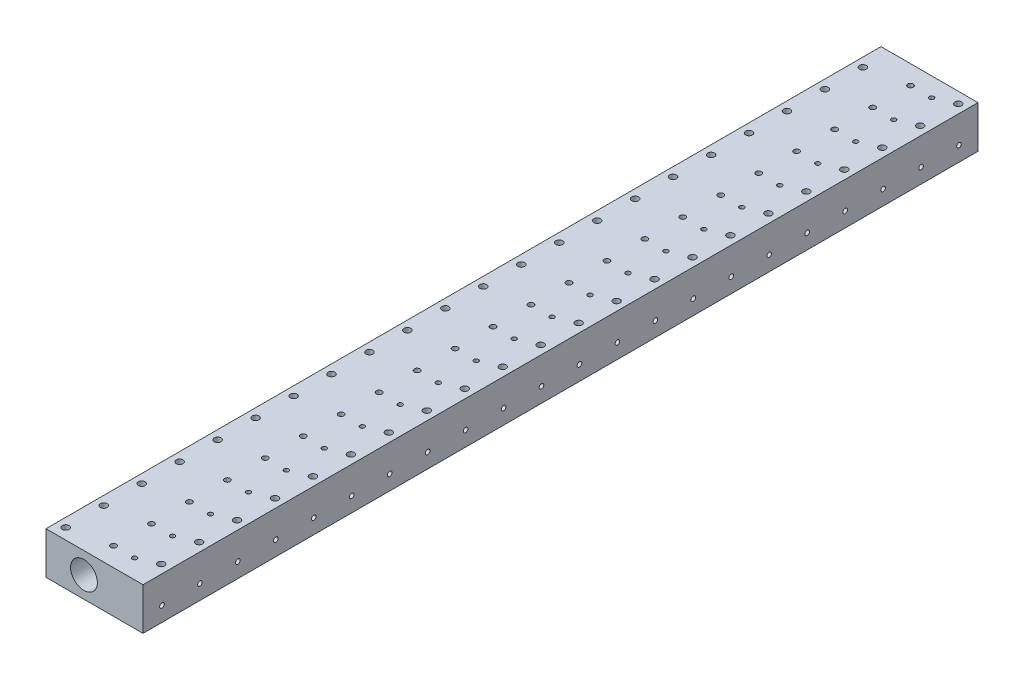
from build123d import *

# Parameters (mm, degrees)
SKETCH1_W                  = 23
SKETCH1_H                  = 10
BOSS_EXTRUDE1_DEPTH        = 198
SKETCH5_R                  = 3.175
CUT_EXTRUDE1_DEPTH         = 199.396698561
M2_TAPPED_HOLE1_AT_2_COUNT = 2
M2_TAPPED_HOLE1_AT_2_PITCH = 19.180198122
LPATTERN1_COUNT            = 22
LPATTERN1_PITCH            = 9


with BuildPart() as part:
    # Sketch1 → Boss-Extrude1 (new body)
    with BuildSketch(Plane.XY):
        Rectangle(SKETCH1_W, SKETCH1_H)
    extrude(amount=-BOSS_EXTRUDE1_DEPTH)

    # Sketch4 → #55 (0.052) Diameter Hole1 (revolve, cut)
    with BuildSketch(Plane(origin=(0, 5, -4.5), x_dir=(0, 0, 1), z_dir=(1, 0, 0))):
        Polygon((0, 0), (0, 7.396808353), (0.6604, 7), (0.6604, 0), align=None)
    f_55_0_052_diameter_hole1 = revolve(axis=Axis((0, 11.35, -4.5), (0, -1, 0)), mode=Mode.SUBTRACT)

    # Sketch5 → Cut-Extrude1 (cut, through all)
    with BuildSketch(Plane.XY):
        with Locations((-2.5, 0)):
            Circle(SKETCH5_R)
    extrude(amount=-CUT_EXTRUDE1_DEPTH, mode=Mode.SUBTRACT)

    # Sketch8 → M2 Tapped Hole1 (revolve, cut)
    with BuildSketch(Plane(origin=(9.4, 5, -6.4), x_dir=(0, 0, 1), z_dir=(1, 0, 0))):
        Polygon((0, 0), (0, 5.680688495), (0.8, 5.2), (0.8, 0), align=None)
    m2_tapped_hole1 = revolve(axis=Axis((9.4, 11.35, -6.4), (0, -1, 0)), mode=Mode.SUBTRACT)

    # M2 Tapped Hole1 at 2: M2 Tapped Hole1 ×2
    with Locations(*[Vector(-0.9801775706589259, 0, 0.1981209983246765) * (i * M2_TAPPED_HOLE1_AT_2_PITCH) for i in range(1, M2_TAPPED_HOLE1_AT_2_COUNT)]):
        add(m2_tapped_hole1, mode=Mode.SUBTRACT)

    # Sketch12 → #57 (0.043) Diameter Hole1 (revolve, cut)
    with BuildSketch(Plane(origin=(11.5, -1.5, -4.5), x_dir=(0, 0, -1), z_dir=(0, 1, 0))):
        Polygon((0, 0), (0, 6.328129984), (0.5461, 6), (0.5461, 0), align=None)
    f_57_0_043_diameter_hole1 = revolve(axis=Axis((17.85, -1.5, -4.5), (-1, 0, 0)), mode=Mode.SUBTRACT)

    # Sketch14 → #57 (0.043) Diameter Hole2 (revolve, cut)
    with BuildSketch(Plane(origin=(5, 5, -4.5), x_dir=(0, 0, 1), z_dir=(1, 0, 0))):
        Polygon((0, 0), (0, 7.828129984), (0.5461, 7.5), (0.5461, 0), align=None)
    f_57_0_043_diameter_hole2 = revolve(axis=Axis((5, 11.35, -4.5), (0, -1, 0)), mode=Mode.SUBTRACT)

    # LPattern1: #55 (0.052) Diameter Hole1, M2 Tapped Hole1, #57 (0.043) Diameter Hole1, #57 (0.043) Diameter Hole2 ×22
    with Locations(*[(0, 0, -i * LPATTERN1_PITCH) for i in range(1, LPATTERN1_COUNT)]):
        add(f_55_0_052_diameter_hole1, mode=Mode.SUBTRACT)
        add(m2_tapped_hole1, mode=Mode.SUBTRACT)
        add(f_57_0_043_diameter_hole1, mode=Mode.SUBTRACT)
        add(f_57_0_043_diameter_hole2, mode=Mode.SUBTRACT)

    # LPattern1 copy 1 sketch → LPattern1 copy 1 (revolve, cut)
    with BuildSketch(Plane(origin=(-9.4, 5, -11.6), x_dir=(0, 0, 1), z_dir=(1, 0, 0))):
        Polygon((0, 0), (0, 5.680688495), (0.8, 5.2), (0.8, 0), align=None)
    revolve(axis=Axis((-9.4, 11.35, -11.6), (0, -1, 0)), mode=Mode.SUBTRACT)

    # LPattern1 copy 2 sketch → LPattern1 copy 2 (revolve, cut)
    with BuildSketch(Plane(origin=(-9.4, 5, -20.6), x_dir=(0, 0, 1), z_dir=(1, 0, 0))):
        Polygon((0, 0), (0, 5.680688495), (0.8, 5.2), (0.8, 0), align=None)
    revolve(axis=Axis((-9.4, 11.35, -20.6), (0, -1, 0)), mode=Mode.SUBTRACT)

    # LPattern1 copy 3 sketch → LPattern1 copy 3 (revolve, cut)
    with BuildSketch(Plane(origin=(-9.4, 5, -29.6), x_dir=(0, 0, 1), z_dir=(1, 0, 0))):
        Polygon((0, 0), (0, 5.680688495), (0.8, 5.2), (0.8, 0), align=None)
    revolve(axis=Axis((-9.4, 11.35, -29.6), (0, -1, 0)), mode=Mode.SUBTRACT)

    # LPattern1 copy 4 sketch → LPattern1 copy 4 (revolve, cut)
    with BuildSketch(Plane(origin=(-9.4, 5, -38.6), x_dir=(0, 0, 1), z_dir=(1, 0, 0))):
        Polygon((0, 0), (0, 5.680688495), (0.8, 5.2), (0.8, 0), align=None)
    revolve(axis=Axis((-9.4, 11.35, -38.6), (0, -1, 0)), mode=Mode.SUBTRACT)

    # LPattern1 copy 5 sketch → LPattern1 copy 5 (revolve, cut)
    with BuildSketch(Plane(origin=(-9.4, 5, -47.6), x_dir=(0, 0, 1), z_dir=(1, 0, 0))):
        Polygon((0, 0), (0, 5.680688495), (0.8, 5.2), (0.8, 0), align=None)
    revolve(axis=Axis((-9.4, 11.35, -47.6), (0, -1, 0)), mode=Mode.SUBTRACT)

    # LPattern1 copy 6 sketch → LPattern1 copy 6 (revolve, cut)
    with BuildSketch(Plane(origin=(-9.4, 5, -56.6), x_dir=(0, 0, 1), z_dir=(1, 0, 0))):
        Polygon((0, 0), (0, 5.680688495), (0.8, 5.2), (0.8, 0), align=None)
    revolve(axis=Axis((-9.4, 11.35, -56.6), (0, -1, 0)), mode=Mode.SUBTRACT)

    # LPattern1 copy 7 sketch → LPattern1 copy 7 (revolve, cut)
    with BuildSketch(Plane(origin=(-9.4, 5, -65.6), x_dir=(0, 0, 1), z_dir=(1, 0, 0))):
        Polygon((0, 0), (0, 5.680688495), (0.8, 5.2), (0.8, 0), align=None)
    revolve(axis=Axis((-9.4, 11.35, -65.6), (0, -1, 0)), mode=Mode.SUBTRACT)

    # LPattern1 copy 8 sketch → LPattern1 copy 8 (revolve, cut)
    with BuildSketch(Plane(origin=(-9.4, 5, -74.6), x_dir=(0, 0, 1), z_dir=(1, 0, 0))):
        Polygon((0, 0), (0, 5.680688495), (0.8, 5.2), (0.8, 0), align=None)
    revolve(axis=Axis((-9.4, 11.35, -74.6), (0, -1, 0)), mode=Mode.SUBTRACT)

    # LPattern1 copy 9 sketch → LPattern1 copy 9 (revolve, cut)
    with BuildSketch(Plane(origin=(-9.4, 5, -83.6), x_dir=(0, 0, 1), z_dir=(1, 0, 0))):
        Polygon((0, 0), (0, 5.680688495), (0.8, 5.2), (0.8, 0), align=None)
    revolve(axis=Axis((-9.4, 11.35, -83.6), (0, -1, 0)), mode=Mode.SUBTRACT)

    # LPattern1 copy 10 sketch → LPattern1 copy 10 (revolve, cut)
    with BuildSketch(Plane(origin=(-9.4, 5, -92.6), x_dir=(0, 0, 1), z_dir=(1, 0, 0))):
        Polygon((0, 0), (0, 5.680688495), (0.8, 5.2), (0.8, 0), align=None)
    revolve(axis=Axis((-9.4, 11.35, -92.6), (0, -1, 0)), mode=Mode.SUBTRACT)

    # LPattern1 copy 11 sketch → LPattern1 copy 11 (revolve, cut)
    with BuildSketch(Plane(origin=(-9.4, 5, -101.6), x_dir=(0, 0, 1), z_dir=(1, 0, 0))):
        Polygon((0, 0), (0, 5.680688495), (0.8, 5.2), (0.8, 0), align=None)
    revolve(axis=Axis((-9.4, 11.35, -101.6), (0, -1, 0)), mode=Mode.SUBTRACT)

    # LPattern1 copy 12 sketch → LPattern1 copy 12 (revolve, cut)
    with BuildSketch(Plane(origin=(-9.4, 5, -110.6), x_dir=(0, 0, 1), z_dir=(1, 0, 0))):
        Polygon((0, 0), (0, 5.680688495), (0.8, 5.2), (0.8, 0), align=None)
    revolve(axis=Axis((-9.4, 11.35, -110.6), (0, -1, 0)), mode=Mode.SUBTRACT)

    # LPattern1 copy 13 sketch → LPattern1 copy 13 (revolve, cut)
    with BuildSketch(Plane(origin=(-9.4, 5, -119.6), x_dir=(0, 0, 1), z_dir=(1, 0, 0))):
        Polygon((0, 0), (0, 5.680688495), (0.8, 5.2), (0.8, 0), align=None)
    revolve(axis=Axis((-9.4, 11.35, -119.6), (0, -1, 0)), mode=Mode.SUBTRACT)

    # LPattern1 copy 14 sketch → LPattern1 copy 14 (revolve, cut)
    with BuildSketch(Plane(origin=(-9.4, 5, -128.6), x_dir=(0, 0, 1), z_dir=(1, 0, 0))):
        Polygon((0, 0), (0, 5.680688495), (0.8, 5.2), (0.8, 0), align=None)
    revolve(axis=Axis((-9.4, 11.35, -128.6), (0, -1, 0)), mode=Mode.SUBTRACT)

    # LPattern1 copy 15 sketch → LPattern1 copy 15 (revolve, cut)
    with BuildSketch(Plane(origin=(-9.4, 5, -137.6), x_dir=(0, 0, 1), z_dir=(1, 0, 0))):
        Polygon((0, 0), (0, 5.680688495), (0.8, 5.2), (0.8, 0), align=None)
    revolve(axis=Axis((-9.4, 11.35, -137.6), (0, -1, 0)), mode=Mode.SUBTRACT)

    # LPattern1 copy 16 sketch → LPattern1 copy 16 (revolve, cut)
    with BuildSketch(Plane(origin=(-9.4, 5, -146.6), x_dir=(0, 0, 1), z_dir=(1, 0, 0))):
        Polygon((0, 0), (0, 5.680688495), (0.8, 5.2), (0.8, 0), align=None)
    revolve(axis=Axis((-9.4, 11.35, -146.6), (0, -1, 0)), mode=Mode.SUBTRACT)

    # LPattern1 copy 17 sketch → LPattern1 copy 17 (revolve, cut)
    with BuildSketch(Plane(origin=(-9.4, 5, -155.6), x_dir=(0, 0, 1), z_dir=(1, 0, 0))):
        Polygon((0, 0), (0, 5.680688495), (0.8, 5.2), (0.8, 0), align=None)
    revolve(axis=Axis((-9.4, 11.35, -155.6), (0, -1, 0)), mode=Mode.SUBTRACT)

    # LPattern1 copy 18 sketch → LPattern1 copy 18 (revolve, cut)
    with BuildSketch(Plane(origin=(-9.4, 5, -164.6), x_dir=(0, 0, 1), z_dir=(1, 0, 0))):
        Polygon((0, 0), (0, 5.680688495), (0.8, 5.2), (0.8, 0), align=None)
    revolve(axis=Axis((-9.4, 11.35, -164.6), (0, -1, 0)), mode=Mode.SUBTRACT)

    # LPattern1 copy 19 sketch → LPattern1 copy 19 (revolve, cut)
    with BuildSketch(Plane(origin=(-9.4, 5, -173.6), x_dir=(0, 0, 1), z_dir=(1, 0, 0))):
        Polygon((0, 0), (0, 5.680688495), (0.8, 5.2), (0.8, 0), align=None)
    revolve(axis=Axis((-9.4, 11.35, -173.6), (0, -1, 0)), mode=Mode.SUBTRACT)

    # LPattern1 copy 20 sketch → LPattern1 copy 20 (revolve, cut)
    with BuildSketch(Plane(origin=(-9.4, 5, -182.6), x_dir=(0, 0, 1), z_dir=(1, 0, 0))):
        Polygon((0, 0), (0, 5.680688495), (0.8, 5.2), (0.8, 0), align=None)
    revolve(axis=Axis((-9.4, 11.35, -182.6), (0, -1, 0)), mode=Mode.SUBTRACT)

    # LPattern1 copy 21 sketch → LPattern1 copy 21 (revolve, cut)
    with BuildSketch(Plane(origin=(-9.4, 5, -191.6), x_dir=(0, 0, 1), z_dir=(1, 0, 0))):
        Polygon((0, 0), (0, 5.680688495), (0.8, 5.2), (0.8, 0), align=None)
    revolve(axis=Axis((-9.4, 11.35, -191.6), (0, -1, 0)), mode=Mode.SUBTRACT)


solid = part.part
